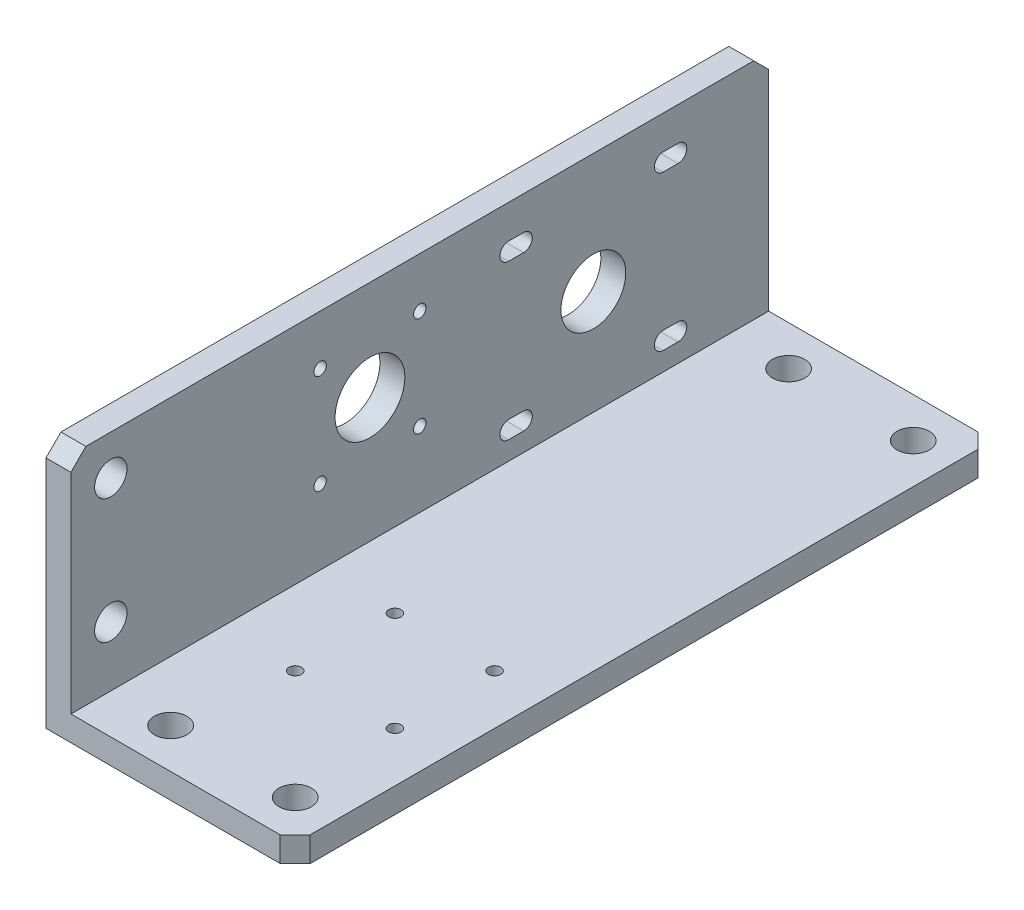
from build123d import *

# Parameters (mm, degrees)
ESTRUSIONE_ESTRUSIONE1_DEPTH = 140
FORO_6_5_6_5_1_D             = 6.5
FORO_6_5_6_5_2_D             = 6.5
FORO_6_5_6_5_2_DEPTH         = 5
FORO_6_5_6_5_2_TIP           = 1.952797012
TAGLIO_ESTRUSIONE3_REACH     = 158.844
SCHIZZO10_R                  = 7
TAGLIO_ESTRUSIONE6_REACH     = 158.844
SCHIZZO13_R                  = 6.5
SMUSSO1_SIZE                 = 3
M3_TAPPED_HOLE1_D            = 2.5
M3_TAPPED_HOLE2_D            = 2.5


with BuildPart() as part:
    # Schizzo1 → Estrusione-Estrusione1 (new body)
    with BuildSketch(Plane.XY):
        Polygon((0, 0), (0, 50), (5, 50), (5, 5), (50, 5), (50, 0), align=None)
    extrude(amount=ESTRUSIONE_ESTRUSIONE1_DEPTH)

    # Foro Ø6.5 (6.5)-1 (through all)
    with Locations(Plane(origin=(0, 0, 0), x_dir=(-1, 0, 0), z_dir=(0, -1, 0))):
        with Locations((-17, -132), (-42, -132)):
            foro_6_5_6_5_1 = Hole(FORO_6_5_6_5_1_D / 2)

    # Foro Ø6.5 (6.5)-2
    with Locations(Plane.ZY):
        with Locations((132, 42), (132, 17)):
            Hole(FORO_6_5_6_5_2_D / 2, depth=FORO_6_5_6_5_2_DEPTH)
            with Locations((0, 0, -(FORO_6_5_6_5_2_DEPTH + FORO_6_5_6_5_2_TIP / 2))):  # 118° drill point
                Cone(0, FORO_6_5_6_5_2_D / 2, FORO_6_5_6_5_2_TIP, mode=Mode.SUBTRACT)

    # Specchia1: Foro Ø6.5 (6.5)-1 across plane
    add(foro_6_5_6_5_1.mirror(Plane.XY.offset(70)), mode=Mode.SUBTRACT)

    # Schizzo10 → Taglio-Estrusione3 (cut, up to next)
    with BuildSketch(Plane.ZY, mode=Mode.PRIVATE) as taglio_estrusione3_sk1:
        with Locations((80, 30)):
            Circle(SCHIZZO10_R)
    taglio_estrusione3_tool1 = extrude(taglio_estrusione3_sk1.sketch, amount=-TAGLIO_ESTRUSIONE3_REACH, mode=Mode.PRIVATE) & part.part
    add(taglio_estrusione3_tool1.solids().sort_by_distance((0, 30, 80))[0], mode=Mode.SUBTRACT)

    # Schizzo13 → Taglio-Estrusione6 (cut, up to next)
    with BuildSketch(Plane.ZY, mode=Mode.PRIVATE) as taglio_estrusione6_sk1:
        with Locations((35.178130338, 26)):
            Circle(SCHIZZO13_R)
    taglio_estrusione6_tool1 = extrude(taglio_estrusione6_sk1.sketch, amount=-TAGLIO_ESTRUSIONE6_REACH, mode=Mode.PRIVATE) & part.part
    # Schizzo13 → Taglio-Estrusione6 (cut, up to next)
    with BuildSketch(Plane.ZY, mode=Mode.PRIVATE) as taglio_estrusione6_sk2:
        with BuildLine():
            Line((18.178130338, 43.25), (21.178130338, 43.25))
            ThreePointArc((21.178130338, 43.25), (22.928130338, 41.5), (21.178130338, 39.75))
            Line((21.178130338, 39.75), (18.178130338, 39.75))
            ThreePointArc((18.178130338, 39.75), (16.428130338, 41.5), (18.178130338, 43.25))
        make_face()
    taglio_estrusione6_tool2 = extrude(taglio_estrusione6_sk2.sketch, amount=-TAGLIO_ESTRUSIONE6_REACH, mode=Mode.PRIVATE) & part.part
    # Schizzo13 → Taglio-Estrusione6 (cut, up to next)
    with BuildSketch(Plane.ZY, mode=Mode.PRIVATE) as taglio_estrusione6_sk3:
        with BuildLine():
            Line((18.178130338, 8.75), (21.178130338, 8.75))
            ThreePointArc((21.178130338, 8.75), (22.928130338, 10.5), (21.178130338, 12.25))
            Line((21.178130338, 12.25), (18.178130338, 12.25))
            ThreePointArc((18.178130338, 12.25), (16.428130338, 10.5), (18.178130338, 8.75))
        make_face()
    taglio_estrusione6_tool3 = extrude(taglio_estrusione6_sk3.sketch, amount=-TAGLIO_ESTRUSIONE6_REACH, mode=Mode.PRIVATE) & part.part
    # Schizzo13 → Taglio-Estrusione6 (cut, up to next)
    with BuildSketch(Plane.ZY, mode=Mode.PRIVATE) as taglio_estrusione6_sk4:
        with BuildLine():
            Line((52.178130338, 43.25), (49.178130338, 43.25))
            ThreePointArc((49.178130338, 43.25), (47.428130338, 41.5), (49.178130338, 39.75))
            Line((49.178130338, 39.75), (52.178130338, 39.75))
            ThreePointArc((52.178130338, 39.75), (53.928130338, 41.5), (52.178130338, 43.25))
        make_face()
    taglio_estrusione6_tool4 = extrude(taglio_estrusione6_sk4.sketch, amount=-TAGLIO_ESTRUSIONE6_REACH, mode=Mode.PRIVATE) & part.part
    # Schizzo13 → Taglio-Estrusione6 (cut, up to next)
    with BuildSketch(Plane.ZY, mode=Mode.PRIVATE) as taglio_estrusione6_sk5:
        with BuildLine():
            Line((52.178130338, 8.75), (49.178130338, 8.75))
            ThreePointArc((49.178130338, 8.75), (47.428130338, 10.5), (49.178130338, 12.25))
            Line((49.178130338, 12.25), (52.178130338, 12.25))
            ThreePointArc((52.178130338, 12.25), (53.928130338, 10.5), (52.178130338, 8.75))
        make_face()
    taglio_estrusione6_tool5 = extrude(taglio_estrusione6_sk5.sketch, amount=-TAGLIO_ESTRUSIONE6_REACH, mode=Mode.PRIVATE) & part.part
    add(taglio_estrusione6_tool1.solids().sort_by_distance((0, 26, 35.17813))[0], mode=Mode.SUBTRACT)
    add(taglio_estrusione6_tool2.solids().sort_by_distance((0, 41.5, 19.67813))[0], mode=Mode.SUBTRACT)
    add(taglio_estrusione6_tool3.solids().sort_by_distance((0, 10.5, 19.67813))[0], mode=Mode.SUBTRACT)
    add(taglio_estrusione6_tool4.solids().sort_by_distance((0, 41.5, 50.67813))[0], mode=Mode.SUBTRACT)
    add(taglio_estrusione6_tool5.solids().sort_by_distance((0, 10.5, 50.67813))[0], mode=Mode.SUBTRACT)

    # Smusso1
    smusso1_edges = [part.edges().sort_by_distance(p)[0] for p in [
        (50, 2.5, 0),
        (2.5, 50, 0),
        (50, 2.5, 140),
        (2.5, 50, 140),
    ]]
    chamfer(smusso1_edges, length=SMUSSO1_SIZE)

    # M3 Tapped Hole1 (through all)
    with Locations(Plane(origin=(0, 40, 70), x_dir=(0, 0, -1), z_dir=(-1, 0, 0))):
        with Locations((0, 0), (-20, 0), (-20, 20), (0, 20)):
            Hole(M3_TAPPED_HOLE1_D / 2)

    # M3 Tapped Hole2 (through all)
    with Locations(Plane(origin=(20, 0, 110), x_dir=(-1, 0, 0), z_dir=(0, -1, 0))):
        with Locations((0, 0), (-20, 0), (-20, 20), (0, 20)):
            Hole(M3_TAPPED_HOLE2_D / 2)


solid = part.part
